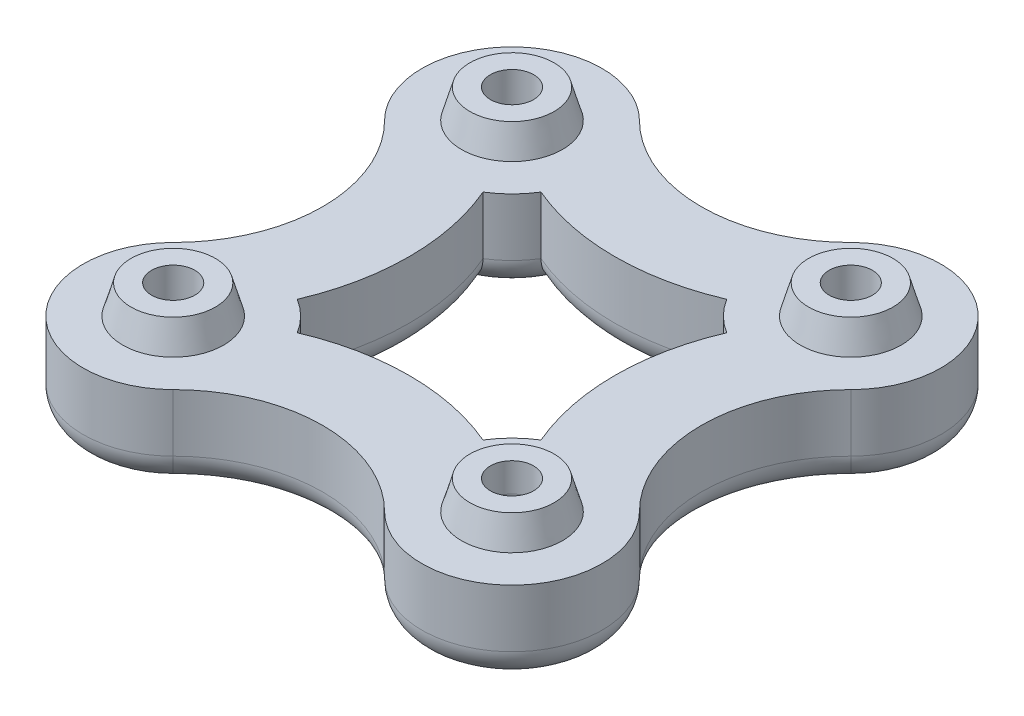
from build123d import *

# Parameters (mm, degrees)
BASE_DEPTH                      = 6
SKETCH6_R                       = 3.5
BEARING_SUPPORT_DEPTH           = 2
BEARING_SUPPORT_TAPER           = 16
ROOM_START                      = -6
HEX_XSEC_R                      = 3
ROOM_FOR_SCREW_HEAD_DEPTH       = 3
BOLT_START                      = 2
SKETCH15_R                      = 1.5
BOLT_HOLE_DEPTH                 = 29.153393661
SCREW_FILLET_R                  = 1
SCREW_FILLET_OF_BASE_MIRROR_I_R = 1
BASE_START                      = -6
BASE_MIRROR_II_OUTLINE_R        = 3
BASE_MIRROR_II_DEPTH            = 6
BASE_START_2                    = -2.0000001
BASE_MIRROR_II_2_OUTLINE_R      = 3
BASE_MIRROR_II_2_OUTLINE_R_2    = 1.5
BASE_MIRROR_II_2_DEPTH          = 2.0000001
FILLET2_R                       = 2


with BuildPart() as part:
    # Sketch14 → base (new body)
    with BuildSketch(Plane(origin=(0, 0, 0), x_dir=(1, 0, 0), z_dir=(0, 1, 0))):
        with BuildLine():
            Line((7.132990642, 0), (13.132990642, 0))
            ThreePointArc((13.132990642, 0), (13.922132241, -3.967282724), (16.169417382, -7.330582618))
            ThreePointArc((16.169417382, -7.330582618), (16.169417382, -16.169417382), (7.330582618, -16.169417382))
            ThreePointArc((7.330582618, -16.169417382), (3.967282724, -13.922132241), (0, -13.132990642))
            Line((0, -13.132990642), (0, -7.132990642))
            ThreePointArc((0, -7.132990642), (3.287059344, -7.466465262), (6.440172303, -8.453300161))
            ThreePointArc((6.440172303, -8.453300161), (7.330582618, -7.330582618), (8.453300161, -6.440172303))
            ThreePointArc((8.453300161, -6.440172303), (7.466465262, -3.287059344), (7.132990642, 0))
        make_face()
    base = extrude(amount=-BASE_DEPTH)

    # hex xsec → room for screw head (cut)
    with BuildSketch(Plane(origin=(0, 0, 0), x_dir=(1, 0, 0), z_dir=(0, 1, 0)).offset(ROOM_START)):
        with Locations(Location((11.75, -11.75, 0), (0, 0, 270))):
            Circle(HEX_XSEC_R)
    room_for_screw_head = extrude(amount=ROOM_FOR_SCREW_HEAD_DEPTH, mode=Mode.SUBTRACT)


with BuildPart() as body_2:
    # Sketch6 → bearing support (new body)
    with BuildSketch(Plane(origin=(0, 0, 0), x_dir=(1, 0, 0), z_dir=(0, 1, 0))):
        with Locations((11.75, -11.75)):
            Circle(SKETCH6_R)
    bearing_support = extrude(amount=BEARING_SUPPORT_DEPTH, taper=BEARING_SUPPORT_TAPER)


with BuildPart() as bolt_hole_tool:
    # Sketch15 → bolt hole (new, through all)
    with BuildSketch(Plane(origin=(0, 0, 0), x_dir=(1, 0, 0), z_dir=(0, 1, 0)).offset(BOLT_START)):
        with Locations(Location((11.75, -11.75, 0), (0, 0, 270))):
            Circle(SKETCH15_R)
    bolt_hole = extrude(amount=-BOLT_HOLE_DEPTH)


with BuildPart() as part_1:
    add(part.part)

    # bolt hole: cut by bolt_hole_tool
    add(bolt_hole_tool.part, mode=Mode.SUBTRACT)

    # screw fillet
    screw_fillet_edges = [part_1.edges().sort_by_distance(p)[0] for p in [
        (11.75, -3, 10.25),
    ]]
    fillet(screw_fillet_edges, radius=SCREW_FILLET_R)

    # base mirror i: base, bearing support, room for screw head, bolt hole across plane
    add(base.mirror(Plane.XY))
    add(bearing_support.mirror(Plane.XY))
    add(room_for_screw_head.mirror(Plane.XY), mode=Mode.SUBTRACT)
    add(bolt_hole.mirror(Plane.XY), mode=Mode.SUBTRACT)

    # screw fillet of base mirror i
    screw_fillet_of_base_mirror_i_edges = [part_1.edges().sort_by_distance(p)[0] for p in [
        (11.75, -3, -10.25),
    ]]
    fillet(screw_fillet_of_base_mirror_i_edges, radius=SCREW_FILLET_OF_BASE_MIRROR_I_R)

    # base mirror ii: read off the stored shape, not the designer's step
    # base mirror ii outline → base mirror ii (add)
    with BuildSketch(Plane(origin=(0, 0, 0), x_dir=(1, 0, 0), z_dir=(0, 1, 0)).offset(BASE_START)):
        with BuildLine():
            ThreePointArc((-7.330582618, -16.169417382), (-3.967282725, -13.922132241), (0, -13.132990642))
            Line((0, -13.132990642), (0, -7.132990642))
            ThreePointArc((0, -7.132990642), (-3.287059344, -7.466465262), (-6.440172303, -8.453300161))
            ThreePointArc((-6.440172303, -8.453300161), (-7.330582618, -7.330582618), (-8.453300161, -6.440172303))
            ThreePointArc((-8.453300161, -6.440172303), (-7.132990642, 0), (-8.453300161, 6.440172303))
            ThreePointArc((-8.453300161, 6.440172303), (-7.330582618, 7.330582618), (-6.440172303, 8.453300161))
            ThreePointArc((-6.440172303, 8.453300161), (-3.287059344, 7.466465262), (0, 7.132990642))
            Line((0, 7.132990642), (0, 13.132990642))
            ThreePointArc((0, 13.132990642), (-3.967282725, 13.922132241), (-7.330582618, 16.169417382))
            ThreePointArc((-7.330582618, 16.169417382), (-16.169417382, 16.169417382), (-16.169417382, 7.330582618))
            ThreePointArc((-16.169417382, 7.330582618), (-13.132990642, 0), (-16.169417382, -7.330582618))
            ThreePointArc((-16.169417382, -7.330582618), (-16.169417382, -16.169417382), (-7.330582618, -16.169417382))
        make_face()
        with Locations((-11.75, -11.75)):
            Circle(BASE_MIRROR_II_OUTLINE_R, mode=Mode.SUBTRACT)
        with Locations((-11.75, 11.75)):
            Circle(BASE_MIRROR_II_OUTLINE_R, mode=Mode.SUBTRACT)
    extrude(amount=BASE_MIRROR_II_DEPTH)

    # base mirror ii 2 outline → base mirror ii 2 (add)
    # profile 1 of 2: a face of its own
    with BuildSketch(Plane(origin=(0, 0, 0), x_dir=(1, 0, 0), z_dir=(0, 1, 0)).offset(BASE_START_2)):
        with Locations((-11.75, -11.75)):
            Circle(BASE_MIRROR_II_2_OUTLINE_R)
        with Locations((-11.75, -11.75)):
            Circle(BASE_MIRROR_II_2_OUTLINE_R_2, mode=Mode.SUBTRACT)
    # profile 2 of 2: a face of its own
    with BuildSketch(Plane(origin=(0, 0, 0), x_dir=(1, 0, 0), z_dir=(0, 1, 0)).offset(BASE_START_2)):
        with Locations((-11.75, 11.75)):
            Circle(BASE_MIRROR_II_2_OUTLINE_R)
        with Locations((-11.75, 11.75)):
            Circle(BASE_MIRROR_II_2_OUTLINE_R_2, mode=Mode.SUBTRACT)
    extrude(amount=BASE_MIRROR_II_2_DEPTH)

    # base mirror ii 3 outline → base mirror ii 3 (revolve)
    with BuildSketch(Plane(origin=(-11.75, 0, 11.75), x_dir=(1, 0, 0), z_dir=(0, 0, 1))):
        with BuildLine():
            ThreePointArc((1.5, -2), (1.792893219, -2.707106781), (2.5, -3))
            Line((2.5, -3), (3, -3))
            Line((3, -3), (3, -2.0000001))
            Line((3, -2.0000001), (1.5, -2))
        make_face()
        Polygon((1.5, 2), (1.5, 0), (3.5, 0), (2.926509228, 2), align=None)
    revolve(axis=Axis((-11.75, 0, 11.75), (0, 1, 0)))

    # base mirror ii 4 outline → base mirror ii 4 (revolve)
    with BuildSketch(Plane(origin=(-11.75, 0, -11.75), x_dir=(1, 0, 0), z_dir=(0, 0, 1))):
        with BuildLine():
            ThreePointArc((1.5, -2), (1.792893219, -2.707106781), (2.5, -3))
            Line((2.5, -3), (3, -3))
            Line((3, -3), (3, -2.0000001))
            Line((3, -2.0000001), (1.5, -2))
        make_face()
        Polygon((1.5, 2), (1.5, 0), (3.5, 0), (2.926509228, 2), align=None)
    revolve(axis=Axis((-11.75, 0, -11.75), (0, 1, 0)))

    # Fillet2
    # the kernel refuses this fillet: 2 mm, written as the material it takes off along each edge
    with BuildSketch(Plane(origin=(23.5, -6, 0), x_dir=(-0.758398101651038, 0, -0.6517916226924841), z_dir=(0.6517916226924841, 0, -0.758398101651038))) as fillet2_piece_1_section:
        with BuildLine():
            CenterArc((16.367009358 - FILLET2_R, FILLET2_R), FILLET2_R, 270, 90)
            Line((16.367009358, FILLET2_R), (16.367009358, 0))
            Line((16.367009358, 0), (16.367009358 - FILLET2_R, 0))
        make_face()
    fillet2_piece_1 = revolve(axis=Axis((23.5, -6, 0), (0, 1, 0)), revolution_arc=81.353638277, mode=Mode.PRIVATE)
    fillet2_piece_1 = fillet2_piece_1 - Plane(origin=(11.75, -6, 11.75), x_dir=(-0.8495724315588705, 0, -0.5274719741703328), z_dir=(0, 1, 0)) * Cylinder(6.25, 66, mode=Mode.PRIVATE)
    fillet2_piece_1 = fillet2_piece_1 - Plane(origin=(11.75, -6, -11.75), x_dir=(-0.8495724315588705, 0, 0.5274719741703328), z_dir=(0, 1, 0)) * Cylinder(6.25, 66, mode=Mode.PRIVATE)
    with BuildSketch(Plane(origin=(11.75, -6, 11.75), x_dir=(-0.9702813927439718, 0, 0.24197937700312022), z_dir=(0.24197937700312022, 0, 0.9702813927439718))) as fillet2_piece_2_section:
        with BuildLine():
            CenterArc((6.25 - FILLET2_R, -FILLET2_R), FILLET2_R, 0, 90)
            Line((6.25, -FILLET2_R), (6.25, 0))
            Line((6.25, 0), (6.25 - FILLET2_R, 0))
        make_face()
    fillet2_piece_2 = revolve(axis=Axis((11.75, -6, 11.75), (0, -1, 0)), revolution_arc=118.006788582, mode=Mode.PRIVATE)
    fillet2_piece_2 = fillet2_piece_2 - Plane(origin=(0, -6, 23.5), x_dir=(0, 0, -1), z_dir=(0, 1, 0)) * Cylinder(16.367009358, 26, mode=Mode.PRIVATE)
    fillet2_piece_2 = fillet2_piece_2 - Plane(origin=(23.5, -6, 0), x_dir=(-0.9193310463476134, 0, 0.3934849771228915), z_dir=(0, 1, 0)) * Cylinder(16.367009358, 26, mode=Mode.PRIVATE)
    with BuildSketch(Plane(origin=(0, -6, 23.5), x_dir=(0, 0, -1), z_dir=(-1, 0, 0))) as fillet2_piece_3_section:
        with BuildLine():
            CenterArc((16.367009358 - FILLET2_R, -FILLET2_R), FILLET2_R, 0, 90)
            Line((16.367009358, -FILLET2_R), (16.367009358, 0))
            Line((16.367009358, 0), (16.367009358 - FILLET2_R, 0))
        make_face()
    fillet2_piece_3 = revolve(axis=Axis((0, -6, 23.5), (0, -1, 0)), revolution_arc=40.675421169, mode=Mode.PRIVATE)
    fillet2_piece_3 = fillet2_piece_3 - Plane(origin=(11.75, -6, 11.75), x_dir=(-0.8495724315588705, 0, -0.5274719741703328), z_dir=(0, 1, 0)) * Cylinder(6.25, 66, mode=Mode.PRIVATE)
    with BuildSketch(Plane(origin=(0, -6, 23.5), x_dir=(0.707106781186553, 0, -0.707106781186542), z_dir=(0.707106781186542, 0, 0.707106781186553))) as fillet2_piece_4:
        with BuildLine():
            CenterArc((10.367009358 + FILLET2_R, FILLET2_R), FILLET2_R, 180, 90)
            Line((10.367009358, FILLET2_R), (10.367009358, 0))
            Line((10.367009358, 0), (10.367009358 + FILLET2_R, 0))
        make_face()
    fillet2_piece_4_solid = revolve(axis=Axis((0, -6, 23.5), (0, 1, 0)), revolution_arc=45, mode=Mode.PRIVATE)
    with BuildSketch(Plane(origin=(11.75, -6, 11.75), x_dir=(0.7071067811865474, 0, -0.7071067811865478), z_dir=(-0.7071067811865478, 0, -0.7071067811865474))) as fillet2_piece_5:
        with BuildLine():
            CenterArc((6.25 - FILLET2_R, -FILLET2_R), FILLET2_R, 0, 90)
            Line((6.25, -FILLET2_R), (6.25, 0))
            Line((6.25, 0), (6.25 - FILLET2_R, 0))
        make_face()
    fillet2_piece_5_solid = revolve(axis=Axis((11.75, -6, 11.75), (0, -1, 0)), revolution_arc=180, mode=Mode.PRIVATE)
    with BuildSketch(Plane(origin=(11.75, -6, -11.75), x_dir=(-0.9702813927439718, 0, -0.24197937700312022), z_dir=(0.24197937700312022, 0, -0.9702813927439718))) as fillet2_piece_6_section:
        with BuildLine():
            CenterArc((6.25 - FILLET2_R, FILLET2_R), FILLET2_R, 270, 90)
            Line((6.25, FILLET2_R), (6.25, 0))
            Line((6.25, 0), (6.25 - FILLET2_R, 0))
        make_face()
    fillet2_piece_6 = revolve(axis=Axis((11.75, -6, -11.75), (0, 1, 0)), revolution_arc=118.006788582, mode=Mode.PRIVATE)
    fillet2_piece_6 = fillet2_piece_6 - Plane(origin=(0, -6, -23.5), x_dir=(0, 0, 1), z_dir=(0, 1, 0)) * Cylinder(16.367009358, 26, mode=Mode.PRIVATE)
    fillet2_piece_6 = fillet2_piece_6 - Plane(origin=(23.5, -6, 0), x_dir=(-0.9193310463476134, 0, 0.3934849771228915), z_dir=(0, 1, 0)) * Cylinder(16.367009358, 26, mode=Mode.PRIVATE)
    with BuildSketch(Plane(origin=(0, -6, -23.5), x_dir=(0, 0, 1), z_dir=(-1, 0, 0))) as fillet2_piece_7_section:
        with BuildLine():
            CenterArc((16.367009358 - FILLET2_R, FILLET2_R), FILLET2_R, 270, 90)
            Line((16.367009358, FILLET2_R), (16.367009358, 0))
            Line((16.367009358, 0), (16.367009358 - FILLET2_R, 0))
        make_face()
    fillet2_piece_7 = revolve(axis=Axis((0, -6, -23.5), (0, 1, 0)), revolution_arc=40.675421169, mode=Mode.PRIVATE)
    fillet2_piece_7 = fillet2_piece_7 - Plane(origin=(11.75, -6, -11.75), x_dir=(-0.8495724315588705, 0, 0.5274719741703328), z_dir=(0, 1, 0)) * Cylinder(6.25, 66, mode=Mode.PRIVATE)
    with BuildSketch(Plane(origin=(0, -6, -23.5), x_dir=(0.707106781186553, 0, 0.707106781186542), z_dir=(0.707106781186542, 0, -0.707106781186553))) as fillet2_piece_8:
        with BuildLine():
            CenterArc((10.367009358 + FILLET2_R, -FILLET2_R), FILLET2_R, 90, 90)
            Line((10.367009358, -FILLET2_R), (10.367009358, 0))
            Line((10.367009358, 0), (10.367009358 + FILLET2_R, 0))
        make_face()
    fillet2_piece_8_solid = revolve(axis=Axis((0, -6, -23.5), (0, -1, 0)), revolution_arc=45, mode=Mode.PRIVATE)
    with BuildSketch(Plane(origin=(11.75, -6, -11.75), x_dir=(0.7071067811865474, 0, 0.7071067811865478), z_dir=(-0.7071067811865478, 0, 0.7071067811865474))) as fillet2_piece_9:
        with BuildLine():
            CenterArc((6.25 - FILLET2_R, FILLET2_R), FILLET2_R, 270, 90)
            Line((6.25, FILLET2_R), (6.25, 0))
            Line((6.25, 0), (6.25 - FILLET2_R, 0))
        make_face()
    fillet2_piece_9_solid = revolve(axis=Axis((11.75, -6, -11.75), (0, 1, 0)), revolution_arc=180, mode=Mode.PRIVATE)
    with BuildSketch(Plane(origin=(23.5, -6, 0), x_dir=(-0.7071067811865441, 0, 0.707106781186551), z_dir=(0.707106781186551, 0, 0.7071067811865441))) as fillet2_piece_10:
        with BuildLine():
            CenterArc((10.367009358 + FILLET2_R, -FILLET2_R), FILLET2_R, 90, 90)
            Line((10.367009358, -FILLET2_R), (10.367009358, 0))
            Line((10.367009358, 0), (10.367009358 + FILLET2_R, 0))
        make_face()
    fillet2_piece_10_solid = revolve(axis=Axis((23.5, -6, 0), (0, -1, 0)), revolution_arc=90, mode=Mode.PRIVATE)
    with BuildSketch(Plane(origin=(-23.500000002, -6, 0), x_dir=(0.707106781264282, 0, -0.7071067811088132), z_dir=(-0.7071067811088132, 0, -0.707106781264282))) as fillet2_piece_11:
        with BuildLine():
            CenterArc((10.36700936 + FILLET2_R, -FILLET2_R), FILLET2_R, 90, 90)
            Line((10.36700936, -FILLET2_R), (10.36700936, 0))
            Line((10.36700936, 0), (10.36700936 + FILLET2_R, 0))
        make_face()
    fillet2_piece_11_solid = revolve(axis=Axis((-23.500000002, -6, 0), (0, -1, 0)), revolution_arc=89.999999987, mode=Mode.PRIVATE)
    with BuildSketch(Plane(origin=(-23.500000005, -6, 0), x_dir=(0.7583981017814437, 0, 0.6517916225407494), z_dir=(-0.6517916225407494, 0, 0.7583981017814437))) as fillet2_piece_12_section:
        with BuildLine():
            CenterArc((16.367009363 - FILLET2_R, FILLET2_R), FILLET2_R, 270, 90)
            Line((16.367009363, FILLET2_R), (16.367009363, 0))
            Line((16.367009363, 0), (16.367009363 - FILLET2_R, 0))
        make_face()
    fillet2_piece_12 = revolve(axis=Axis((-23.500000005, -6, 0), (0, 1, 0)), revolution_arc=81.353638254, mode=Mode.PRIVATE)
    fillet2_piece_12 = fillet2_piece_12 - Plane(origin=(-11.750000016, -6, 11.750000016), x_dir=(0.8495724310696279, 0, -0.5274719749583312), z_dir=(0, -1, 0)) * Cylinder(6.250000023, 66, mode=Mode.PRIVATE)
    fillet2_piece_12 = fillet2_piece_12 - Plane(origin=(-11.750000016, -6, -11.750000016), x_dir=(0.5274719749583312, 0, 0.8495724310696279), z_dir=(0, -1, 0)) * Cylinder(6.250000023, 66, mode=Mode.PRIVATE)
    with BuildSketch(Plane(origin=(-11.750000016, -6, 11.750000016), x_dir=(0.9702813936708831, 0, 0.24197937328642014), z_dir=(-0.24197937328642014, 0, 0.9702813936708831))) as fillet2_piece_13_section:
        with BuildLine():
            CenterArc((6.250000023 - FILLET2_R, FILLET2_R), FILLET2_R, 270, 90)
            Line((6.250000023, FILLET2_R), (6.250000023, 0))
            Line((6.250000023, 0), (6.250000023 - FILLET2_R, 0))
        make_face()
    fillet2_piece_13 = revolve(axis=Axis((-11.750000016, -6, 11.750000016), (0, 1, 0)), revolution_arc=118.006788143, mode=Mode.PRIVATE)
    fillet2_piece_13 = fillet2_piece_13 - Plane(origin=(-23.500000005, -6, 0), x_dir=(0.9193310463908988, 0, 0.39348497702176033), z_dir=(0, -1, 0)) * Cylinder(16.367009363, 26, mode=Mode.PRIVATE)
    fillet2_piece_13 = fillet2_piece_13 - Plane(origin=(1e-09, -6, 23.500000008), x_dir=(-4.358588480433537e-11, 0, -1.0), z_dir=(0, -1, 0)) * Cylinder(16.367009366, 26, mode=Mode.PRIVATE)
    with BuildSketch(Plane(origin=(-11.75, -6, 11.75), x_dir=(-0.7071067811865476, 0, -0.7071067811865476), z_dir=(0.7071067811865476, 0, -0.7071067811865476))) as fillet2_piece_14:
        with BuildLine():
            CenterArc((6.249999999 - FILLET2_R, FILLET2_R), FILLET2_R, 270, 90)
            Line((6.249999999, FILLET2_R), (6.249999999, 0))
            Line((6.249999999, 0), (6.249999999 - FILLET2_R, 0))
        make_face()
    fillet2_piece_14_solid = revolve(axis=Axis((-11.75, -6, 11.75), (0, 1, 0)), revolution_arc=180, mode=Mode.PRIVATE)
    with BuildSketch(Plane(origin=(-11.75, -6, -11.75), x_dir=(0.7071067811865476, 0, -0.7071067811865476), z_dir=(0.7071067811865476, 0, 0.7071067811865476))) as fillet2_piece_15:
        with BuildLine():
            CenterArc((6.249999999 - FILLET2_R, FILLET2_R), FILLET2_R, 270, 90)
            Line((6.249999999, FILLET2_R), (6.249999999, 0))
            Line((6.249999999, 0), (6.249999999 - FILLET2_R, 0))
        make_face()
    fillet2_piece_15_solid = revolve(axis=Axis((-11.75, -6, -11.75), (0, 1, 0)), revolution_arc=180, mode=Mode.PRIVATE)
    with BuildSketch(Plane(origin=(-11.750000016, -6, -11.750000016), x_dir=(-0.2419793732864202, 0, 0.9702813936708832), z_dir=(-0.9702813936708832, 0, -0.2419793732864202))) as fillet2_piece_16_section:
        with BuildLine():
            CenterArc((6.250000023 - FILLET2_R, FILLET2_R), FILLET2_R, 270, 90)
            Line((6.250000023, FILLET2_R), (6.250000023, 0))
            Line((6.250000023, 0), (6.250000023 - FILLET2_R, 0))
        make_face()
    fillet2_piece_16 = revolve(axis=Axis((-11.750000016, -6, -11.750000016), (0, 1, 0)), revolution_arc=118.006788143, mode=Mode.PRIVATE)
    fillet2_piece_16 = fillet2_piece_16 - Plane(origin=(-23.500000005, -6, 0), x_dir=(0.9193310463908988, 0, 0.39348497702176033), z_dir=(0, -1, 0)) * Cylinder(16.367009363, 26, mode=Mode.PRIVATE)
    fillet2_piece_16 = fillet2_piece_16 - Plane(origin=(1e-09, -6, -23.500000008), x_dir=(-0.39348497698169055, 0, 0.9193310464080491), z_dir=(0, -1, 0)) * Cylinder(16.367009366, 26, mode=Mode.PRIVATE)
    with BuildSketch(Plane(origin=(1e-09, -6, -23.500000003), x_dir=(-5.6793923189903254e-11, 0, 1.0), z_dir=(1.0, 0, 5.6793923189903254e-11))) as fillet2_piece_17:
        with BuildLine():
            CenterArc((10.367009361 + FILLET2_R, -FILLET2_R), FILLET2_R, 90, 90)
            Line((10.367009361, -FILLET2_R), (10.367009361, 0))
            Line((10.367009361, 0), (10.367009361 + FILLET2_R, 0))
        make_face()
    fillet2_piece_17_solid = revolve(axis=Axis((1e-09, -6, -23.500000003), (0, -1, 0)), revolution_arc=44.999999987, mode=Mode.PRIVATE)
    with BuildSketch(Plane(origin=(1e-09, -6, 23.500000003), x_dir=(-0.7071067810686538, 0, -0.7071067813044412), z_dir=(-0.7071067813044412, 0, 0.7071067810686538))) as fillet2_piece_18:
        with BuildLine():
            CenterArc((10.367009361 + FILLET2_R, -FILLET2_R), FILLET2_R, 90, 90)
            Line((10.367009361, -FILLET2_R), (10.367009361, 0))
            Line((10.367009361, 0), (10.367009361 + FILLET2_R, 0))
        make_face()
    fillet2_piece_18_solid = revolve(axis=Axis((1e-09, -6, 23.500000003), (0, -1, 0)), revolution_arc=44.999999987, mode=Mode.PRIVATE)
    with BuildSketch(Plane(origin=(1e-09, -6, -23.500000008), x_dir=(-0.6517731179847802, 0, 0.7584140047971146), z_dir=(-0.7584140047971146, 0, -0.6517731179847802))) as fillet2_piece_19_section:
        with BuildLine():
            CenterArc((16.367009366 - FILLET2_R, FILLET2_R), FILLET2_R, 270, 90)
            Line((16.367009366, FILLET2_R), (16.367009366, 0))
            Line((16.367009366, 0), (16.367009366 - FILLET2_R, 0))
        make_face()
    fillet2_piece_19 = revolve(axis=Axis((1e-09, -6, -23.500000008), (0, 1, 0)), revolution_arc=40.675421149, mode=Mode.PRIVATE)
    fillet2_piece_19 = fillet2_piece_19 - Plane(origin=(-11.750000016, -6, -11.750000016), x_dir=(0.5274719749583312, 0, 0.8495724310696279), z_dir=(0, -1, 0)) * Cylinder(6.250000023, 66, mode=Mode.PRIVATE)
    with BuildSketch(Plane(origin=(1e-09, -6, 23.500000008), x_dir=(-4.358588480433537e-11, 0, -1.0), z_dir=(1.0, 0, -4.358588480433537e-11))) as fillet2_piece_20_section:
        with BuildLine():
            CenterArc((16.367009366 - FILLET2_R, FILLET2_R), FILLET2_R, 270, 90)
            Line((16.367009366, FILLET2_R), (16.367009366, 0))
            Line((16.367009366, 0), (16.367009366 - FILLET2_R, 0))
        make_face()
    fillet2_piece_20 = revolve(axis=Axis((1e-09, -6, 23.500000008), (0, 1, 0)), revolution_arc=40.675421149, mode=Mode.PRIVATE)
    fillet2_piece_20 = fillet2_piece_20 - Plane(origin=(-11.750000016, -6, 11.750000016), x_dir=(0.8495724310696279, 0, -0.5274719749583312), z_dir=(0, -1, 0)) * Cylinder(6.250000023, 66, mode=Mode.PRIVATE)
    with BuildSketch(Plane(origin=(23.5, -6, 0), x_dir=(-0.758398101651038, 0, -0.6517916226924841), z_dir=(0.6517916226924841, 0, -0.758398101651038))) as fillet2_piece_21a_section:
        with BuildLine():
            CenterArc((16.367009358 - FILLET2_R, FILLET2_R), FILLET2_R, 270, 90)
            Line((16.367009358, FILLET2_R), (16.367009358, 0))
            Line((16.367009358, 0), (16.367009358 - FILLET2_R, 0))
        make_face()
    fillet2_piece_21a = revolve(axis=Axis((23.5, -6, 0), (0, 1, 0)), revolution_arc=81.353638277, mode=Mode.PRIVATE)
    fillet2_piece_21a = fillet2_piece_21a & Plane(origin=(11.75, -6, -11.75), x_dir=(-0.8495724315588705, 0, 0.5274719741703328), z_dir=(0, 1, 0)) * Cylinder(6.25, 66, mode=Mode.PRIVATE)
    with BuildSketch(Plane(origin=(11.75, -6, -11.75), x_dir=(-0.9702813927439718, 0, -0.24197937700312022), z_dir=(0.24197937700312022, 0, -0.9702813927439718))) as fillet2_piece_21b_section:
        with BuildLine():
            CenterArc((6.25 - FILLET2_R, FILLET2_R), FILLET2_R, 270, 90)
            Line((6.25, FILLET2_R), (6.25, 0))
            Line((6.25, 0), (6.25 - FILLET2_R, 0))
        make_face()
    fillet2_piece_21b = revolve(axis=Axis((11.75, -6, -11.75), (0, 1, 0)), revolution_arc=118.006788582, mode=Mode.PRIVATE)
    fillet2_piece_21b = fillet2_piece_21b & Plane(origin=(23.5, -6, 0), x_dir=(-0.9193310463476134, 0, 0.3934849771228915), z_dir=(0, 1, 0)) * Cylinder(16.367009358, 26, mode=Mode.PRIVATE)
    fillet2_piece_21 = fillet2_piece_21a & fillet2_piece_21b
    with BuildSketch(Plane(origin=(23.5, -6, 0), x_dir=(-0.758398101651038, 0, -0.6517916226924841), z_dir=(0.6517916226924841, 0, -0.758398101651038))) as fillet2_piece_22a_section:
        with BuildLine():
            CenterArc((16.367009358 - FILLET2_R, FILLET2_R), FILLET2_R, 270, 90)
            Line((16.367009358, FILLET2_R), (16.367009358, 0))
            Line((16.367009358, 0), (16.367009358 - FILLET2_R, 0))
        make_face()
    fillet2_piece_22a = revolve(axis=Axis((23.5, -6, 0), (0, 1, 0)), revolution_arc=81.353638277, mode=Mode.PRIVATE)
    fillet2_piece_22a = fillet2_piece_22a & Plane(origin=(11.75, -6, 11.75), x_dir=(-0.8495724315588705, 0, -0.5274719741703328), z_dir=(0, 1, 0)) * Cylinder(6.25, 66, mode=Mode.PRIVATE)
    with BuildSketch(Plane(origin=(11.75, -6, 11.75), x_dir=(-0.9702813927439718, 0, 0.24197937700312022), z_dir=(0.24197937700312022, 0, 0.9702813927439718))) as fillet2_piece_22b_section:
        with BuildLine():
            CenterArc((6.25 - FILLET2_R, -FILLET2_R), FILLET2_R, 0, 90)
            Line((6.25, -FILLET2_R), (6.25, 0))
            Line((6.25, 0), (6.25 - FILLET2_R, 0))
        make_face()
    fillet2_piece_22b = revolve(axis=Axis((11.75, -6, 11.75), (0, -1, 0)), revolution_arc=118.006788582, mode=Mode.PRIVATE)
    fillet2_piece_22b = fillet2_piece_22b & Plane(origin=(23.5, -6, 0), x_dir=(-0.9193310463476134, 0, 0.3934849771228915), z_dir=(0, 1, 0)) * Cylinder(16.367009358, 26, mode=Mode.PRIVATE)
    fillet2_piece_22 = fillet2_piece_22a & fillet2_piece_22b
    with BuildSketch(Plane(origin=(0, -6, 23.5), x_dir=(0, 0, -1), z_dir=(-1, 0, 0))) as fillet2_piece_23a_section:
        with BuildLine():
            CenterArc((16.367009358 - FILLET2_R, -FILLET2_R), FILLET2_R, 0, 90)
            Line((16.367009358, -FILLET2_R), (16.367009358, 0))
            Line((16.367009358, 0), (16.367009358 - FILLET2_R, 0))
        make_face()
    fillet2_piece_23a = revolve(axis=Axis((0, -6, 23.5), (0, -1, 0)), revolution_arc=40.675421169, mode=Mode.PRIVATE)
    fillet2_piece_23a = fillet2_piece_23a & Plane(origin=(11.75, -6, 11.75), x_dir=(-0.8495724315588705, 0, -0.5274719741703328), z_dir=(0, 1, 0)) * Cylinder(6.25, 66, mode=Mode.PRIVATE)
    with BuildSketch(Plane(origin=(11.75, -6, 11.75), x_dir=(-0.9702813927439718, 0, 0.24197937700312022), z_dir=(0.24197937700312022, 0, 0.9702813927439718))) as fillet2_piece_23b_section:
        with BuildLine():
            CenterArc((6.25 - FILLET2_R, -FILLET2_R), FILLET2_R, 0, 90)
            Line((6.25, -FILLET2_R), (6.25, 0))
            Line((6.25, 0), (6.25 - FILLET2_R, 0))
        make_face()
    fillet2_piece_23b = revolve(axis=Axis((11.75, -6, 11.75), (0, -1, 0)), revolution_arc=118.006788582, mode=Mode.PRIVATE)
    fillet2_piece_23b = fillet2_piece_23b & Plane(origin=(0, -6, 23.5), x_dir=(0, 0, -1), z_dir=(0, 1, 0)) * Cylinder(16.367009358, 26, mode=Mode.PRIVATE)
    fillet2_piece_23 = fillet2_piece_23a & fillet2_piece_23b
    with BuildSketch(Plane(origin=(11.75, -6, -11.75), x_dir=(-0.9702813927439718, 0, -0.24197937700312022), z_dir=(0.24197937700312022, 0, -0.9702813927439718))) as fillet2_piece_24a_section:
        with BuildLine():
            CenterArc((6.25 - FILLET2_R, FILLET2_R), FILLET2_R, 270, 90)
            Line((6.25, FILLET2_R), (6.25, 0))
            Line((6.25, 0), (6.25 - FILLET2_R, 0))
        make_face()
    fillet2_piece_24a = revolve(axis=Axis((11.75, -6, -11.75), (0, 1, 0)), revolution_arc=118.006788582, mode=Mode.PRIVATE)
    fillet2_piece_24a = fillet2_piece_24a & Plane(origin=(0, -6, -23.5), x_dir=(0, 0, 1), z_dir=(0, 1, 0)) * Cylinder(16.367009358, 26, mode=Mode.PRIVATE)
    with BuildSketch(Plane(origin=(0, -6, -23.5), x_dir=(0, 0, 1), z_dir=(-1, 0, 0))) as fillet2_piece_24b_section:
        with BuildLine():
            CenterArc((16.367009358 - FILLET2_R, FILLET2_R), FILLET2_R, 270, 90)
            Line((16.367009358, FILLET2_R), (16.367009358, 0))
            Line((16.367009358, 0), (16.367009358 - FILLET2_R, 0))
        make_face()
    fillet2_piece_24b = revolve(axis=Axis((0, -6, -23.5), (0, 1, 0)), revolution_arc=40.675421169, mode=Mode.PRIVATE)
    fillet2_piece_24b = fillet2_piece_24b & Plane(origin=(11.75, -6, -11.75), x_dir=(-0.8495724315588705, 0, 0.5274719741703328), z_dir=(0, 1, 0)) * Cylinder(6.25, 66, mode=Mode.PRIVATE)
    fillet2_piece_24 = fillet2_piece_24a & fillet2_piece_24b
    with BuildSketch(Plane(origin=(-23.500000005, -6, 0), x_dir=(0.7583981017814437, 0, 0.6517916225407494), z_dir=(-0.6517916225407494, 0, 0.7583981017814437))) as fillet2_piece_25a_section:
        with BuildLine():
            CenterArc((16.367009363 - FILLET2_R, FILLET2_R), FILLET2_R, 270, 90)
            Line((16.367009363, FILLET2_R), (16.367009363, 0))
            Line((16.367009363, 0), (16.367009363 - FILLET2_R, 0))
        make_face()
    fillet2_piece_25a = revolve(axis=Axis((-23.500000005, -6, 0), (0, 1, 0)), revolution_arc=81.353638254, mode=Mode.PRIVATE)
    fillet2_piece_25a = fillet2_piece_25a & Plane(origin=(-11.750000016, -6, 11.750000016), x_dir=(0.8495724310696279, 0, -0.5274719749583312), z_dir=(0, -1, 0)) * Cylinder(6.250000023, 66, mode=Mode.PRIVATE)
    with BuildSketch(Plane(origin=(-11.750000016, -6, 11.750000016), x_dir=(0.9702813936708831, 0, 0.24197937328642014), z_dir=(-0.24197937328642014, 0, 0.9702813936708831))) as fillet2_piece_25b_section:
        with BuildLine():
            CenterArc((6.250000023 - FILLET2_R, FILLET2_R), FILLET2_R, 270, 90)
            Line((6.250000023, FILLET2_R), (6.250000023, 0))
            Line((6.250000023, 0), (6.250000023 - FILLET2_R, 0))
        make_face()
    fillet2_piece_25b = revolve(axis=Axis((-11.750000016, -6, 11.750000016), (0, 1, 0)), revolution_arc=118.006788143, mode=Mode.PRIVATE)
    fillet2_piece_25b = fillet2_piece_25b & Plane(origin=(-23.500000005, -6, 0), x_dir=(0.9193310463908988, 0, 0.39348497702176033), z_dir=(0, -1, 0)) * Cylinder(16.367009363, 26, mode=Mode.PRIVATE)
    fillet2_piece_25 = fillet2_piece_25a & fillet2_piece_25b
    with BuildSketch(Plane(origin=(-11.750000016, -6, -11.750000016), x_dir=(-0.2419793732864202, 0, 0.9702813936708832), z_dir=(-0.9702813936708832, 0, -0.2419793732864202))) as fillet2_piece_26a_section:
        with BuildLine():
            CenterArc((6.250000023 - FILLET2_R, FILLET2_R), FILLET2_R, 270, 90)
            Line((6.250000023, FILLET2_R), (6.250000023, 0))
            Line((6.250000023, 0), (6.250000023 - FILLET2_R, 0))
        make_face()
    fillet2_piece_26a = revolve(axis=Axis((-11.750000016, -6, -11.750000016), (0, 1, 0)), revolution_arc=118.006788143, mode=Mode.PRIVATE)
    fillet2_piece_26a = fillet2_piece_26a & Plane(origin=(-23.500000005, -6, 0), x_dir=(0.9193310463908988, 0, 0.39348497702176033), z_dir=(0, -1, 0)) * Cylinder(16.367009363, 26, mode=Mode.PRIVATE)
    with BuildSketch(Plane(origin=(-23.500000005, -6, 0), x_dir=(0.7583981017814437, 0, 0.6517916225407494), z_dir=(-0.6517916225407494, 0, 0.7583981017814437))) as fillet2_piece_26b_section:
        with BuildLine():
            CenterArc((16.367009363 - FILLET2_R, FILLET2_R), FILLET2_R, 270, 90)
            Line((16.367009363, FILLET2_R), (16.367009363, 0))
            Line((16.367009363, 0), (16.367009363 - FILLET2_R, 0))
        make_face()
    fillet2_piece_26b = revolve(axis=Axis((-23.500000005, -6, 0), (0, 1, 0)), revolution_arc=81.353638254, mode=Mode.PRIVATE)
    fillet2_piece_26b = fillet2_piece_26b & Plane(origin=(-11.750000016, -6, -11.750000016), x_dir=(0.5274719749583312, 0, 0.8495724310696279), z_dir=(0, -1, 0)) * Cylinder(6.250000023, 66, mode=Mode.PRIVATE)
    fillet2_piece_26 = fillet2_piece_26a & fillet2_piece_26b
    with BuildSketch(Plane(origin=(-11.750000016, -6, 11.750000016), x_dir=(0.9702813936708831, 0, 0.24197937328642014), z_dir=(-0.24197937328642014, 0, 0.9702813936708831))) as fillet2_piece_27a_section:
        with BuildLine():
            CenterArc((6.250000023 - FILLET2_R, FILLET2_R), FILLET2_R, 270, 90)
            Line((6.250000023, FILLET2_R), (6.250000023, 0))
            Line((6.250000023, 0), (6.250000023 - FILLET2_R, 0))
        make_face()
    fillet2_piece_27a = revolve(axis=Axis((-11.750000016, -6, 11.750000016), (0, 1, 0)), revolution_arc=118.006788143, mode=Mode.PRIVATE)
    fillet2_piece_27a = fillet2_piece_27a & Plane(origin=(1e-09, -6, 23.500000008), x_dir=(-4.358588480433537e-11, 0, -1.0), z_dir=(0, -1, 0)) * Cylinder(16.367009366, 26, mode=Mode.PRIVATE)
    with BuildSketch(Plane(origin=(1e-09, -6, 23.500000008), x_dir=(-4.358588480433537e-11, 0, -1.0), z_dir=(1.0, 0, -4.358588480433537e-11))) as fillet2_piece_27b_section:
        with BuildLine():
            CenterArc((16.367009366 - FILLET2_R, FILLET2_R), FILLET2_R, 270, 90)
            Line((16.367009366, FILLET2_R), (16.367009366, 0))
            Line((16.367009366, 0), (16.367009366 - FILLET2_R, 0))
        make_face()
    fillet2_piece_27b = revolve(axis=Axis((1e-09, -6, 23.500000008), (0, 1, 0)), revolution_arc=40.675421149, mode=Mode.PRIVATE)
    fillet2_piece_27b = fillet2_piece_27b & Plane(origin=(-11.750000016, -6, 11.750000016), x_dir=(0.8495724310696279, 0, -0.5274719749583312), z_dir=(0, -1, 0)) * Cylinder(6.250000023, 66, mode=Mode.PRIVATE)
    fillet2_piece_27 = fillet2_piece_27a & fillet2_piece_27b
    with BuildSketch(Plane(origin=(1e-09, -6, -23.500000008), x_dir=(-0.6517731179847802, 0, 0.7584140047971146), z_dir=(-0.7584140047971146, 0, -0.6517731179847802))) as fillet2_piece_28a_section:
        with BuildLine():
            CenterArc((16.367009366 - FILLET2_R, FILLET2_R), FILLET2_R, 270, 90)
            Line((16.367009366, FILLET2_R), (16.367009366, 0))
            Line((16.367009366, 0), (16.367009366 - FILLET2_R, 0))
        make_face()
    fillet2_piece_28a = revolve(axis=Axis((1e-09, -6, -23.500000008), (0, 1, 0)), revolution_arc=40.675421149, mode=Mode.PRIVATE)
    fillet2_piece_28a = fillet2_piece_28a & Plane(origin=(-11.750000016, -6, -11.750000016), x_dir=(0.5274719749583312, 0, 0.8495724310696279), z_dir=(0, -1, 0)) * Cylinder(6.250000023, 66, mode=Mode.PRIVATE)
    with BuildSketch(Plane(origin=(-11.750000016, -6, -11.750000016), x_dir=(-0.2419793732864202, 0, 0.9702813936708832), z_dir=(-0.9702813936708832, 0, -0.2419793732864202))) as fillet2_piece_28b_section:
        with BuildLine():
            CenterArc((6.250000023 - FILLET2_R, FILLET2_R), FILLET2_R, 270, 90)
            Line((6.250000023, FILLET2_R), (6.250000023, 0))
            Line((6.250000023, 0), (6.250000023 - FILLET2_R, 0))
        make_face()
    fillet2_piece_28b = revolve(axis=Axis((-11.750000016, -6, -11.750000016), (0, 1, 0)), revolution_arc=118.006788143, mode=Mode.PRIVATE)
    fillet2_piece_28b = fillet2_piece_28b & Plane(origin=(1e-09, -6, -23.500000008), x_dir=(-0.39348497698169055, 0, 0.9193310464080491), z_dir=(0, -1, 0)) * Cylinder(16.367009366, 26, mode=Mode.PRIVATE)
    fillet2_piece_28 = fillet2_piece_28a & fillet2_piece_28b
    add([fillet2_piece_1, fillet2_piece_2, fillet2_piece_3, fillet2_piece_4_solid, fillet2_piece_5_solid, fillet2_piece_6, fillet2_piece_7, fillet2_piece_8_solid, fillet2_piece_9_solid, fillet2_piece_10_solid, fillet2_piece_11_solid, fillet2_piece_12, fillet2_piece_13, fillet2_piece_14_solid, fillet2_piece_15_solid, fillet2_piece_16, fillet2_piece_17_solid, fillet2_piece_18_solid, fillet2_piece_19, fillet2_piece_20, fillet2_piece_21, fillet2_piece_22, fillet2_piece_23, fillet2_piece_24, fillet2_piece_25, fillet2_piece_26, fillet2_piece_27, fillet2_piece_28], mode=Mode.SUBTRACT)


with BuildPart() as body_2_1:
    add(body_2.part)

    # bolt hole: cut by bolt_hole_tool
    add(bolt_hole_tool.part, mode=Mode.SUBTRACT)


solid = Compound([part_1.part, body_2_1.part])
